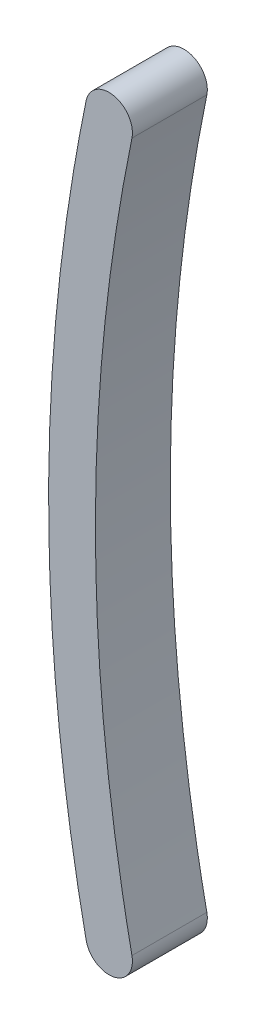
from build123d import *

# Parameters (mm, degrees)
EXTRUDE_THIN1_DEPTH = 2.54
CUT_EXTRUDE2_DEPTH  = 2.54


# Read off the part's stored shape, not the designer's step: Extrude-Thin1
with BuildPart() as part:
    # Extrude-Thin1 outline → Extrude-Thin1 (new body)
    with BuildSketch(Plane.XY):
        with BuildLine():
            Line((-18.692687667, -12.068059878), (-17.759839079, -11.875576731))
            add(Edge.make_bspline(
                [(-17.759839079, -11.875576731), (-18.573783236, -7.930886077), (-18.979144718, -3.99656527), (-18.979144707, 3.871633241), (-18.573783214, 7.805954051), (-17.759839047, 11.750644712)],
                knots=[0, 0, 0, 0, 0.5, 0.5, 1, 1, 1, 1], degree=3))
            Line((-17.759839047, 11.750644712), (-18.692687625, 11.943127906))
            ThreePointArc((-18.692687625, 11.943127906), (-19.309658792, 12.880904316), (-20.247435255, 12.26393323))
            add(Edge.make_bspline(
                [(-20.247435289, -12.388865244), (-22.790854154, -0.062466015), (-20.247435255, 12.26393323)],
                knots=[0, 0, 0, 1, 1, 1], degree=2))
            ThreePointArc((-20.247435289, -12.388865244), (-19.309658791, -13.005836389), (-18.692687667, -12.068059878))
        make_face()
    extrude(amount=EXTRUDE_THIN1_DEPTH)

    # Sketch2 → Cut-Extrude2 (cut)
    with BuildSketch(Plane.XY.offset(2.54)):
        with BuildLine():
            Line((-18.692687658, -12.068059924), (-17.759839079, -11.875576731))
            add(Edge.make_bspline(
                [(-17.759839079, -11.875576731), (-20.198448987, -0.061149061), (-17.759839047, 11.750644712)],
                knots=[0, 0, 0, 1, 1, 1], degree=2))
            Line((-17.759839047, 11.750644712), (-18.692687625, 11.943127906))
            add(Edge.make_bspline(
                [(-18.692687625, 11.943127906), (-19.102025507, 9.959316995), (-19.727363165, 5.928682969), (-20.033785482, -0.06246601), (-19.727363182, -6.053614989), (-19.102025535, -10.084249013), (-18.692687658, -12.068059924)],
                knots=[0, 0, 0, 0, 0.25, 0.5, 0.75, 1, 1, 1, 1], degree=3))
        make_face()
    extrude(amount=-CUT_EXTRUDE2_DEPTH, mode=Mode.SUBTRACT)


with BuildPart() as cut_extrude2_kept_piece:
    # of the separate pieces the step leaves, the one the design keeps (cut_extrude2_pieces_kept)
    add(part.part.solids().sort_by_distance((-20.247435289, -12.388865244, 0))[0])


solid = cut_extrude2_kept_piece.part
